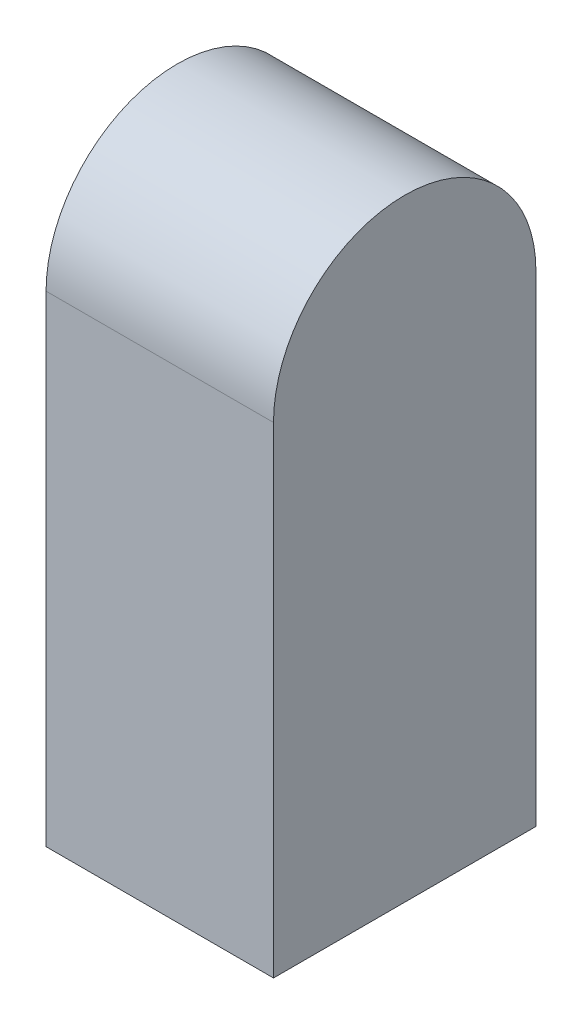
from build123d import *

# Parameters (mm, degrees)
BOSS_EXTRUDE1_DEPTH     = 2
EXTRUDE_THIN2_START     = 50
EXTRUDE_THIN2_DEPTH     = 50
RIB2_START              = -2
RIB2_OUTLINE_W          = 51
RIB2_OUTLINE_H          = 3
RIB2_DEPTH              = 4
RIB14_START             = -2
RIB14_OUTLINE_W         = 50
RIB14_OUTLINE_H         = 1
RIB14_DEPTH             = 4
LPATTERN1_COUNT         = 3
LPATTERN1_PITCH         = 53
MIRROR1_START           = -2
MIRROR1_COPY_1_SKETCH_W = 50
MIRROR1_COPY_1_SKETCH_H = 1
MIRROR1_COPY_1_DEPTH    = 4
MIRROR1_COPY_2_SKETCH_W = 50
MIRROR1_COPY_2_SKETCH_H = 1
MIRROR1_COPY_2_DEPTH    = 4
SKETCH6_R               = 1
CUT_EXTRUDE1_DEPTH      = 10


# Read off the part's stored shape, not the designer's step: Rib2, Rib14
with BuildPart() as part:
    # Sketch2 → Boss-Extrude1 (new body)
    with BuildSketch(Plane(origin=(0, 0, 0), x_dir=(0, 0, -1), z_dir=(1, 0, 0))):
        with BuildLine():
            Line((30, -70), (-30, -70))
            Line((-30, -70), (-30, 40))
            ThreePointArc((-30, 40), (0, 70), (30, 40))
            Line((30, 40), (30, -70))
        make_face()
    extrude(amount=BOSS_EXTRUDE1_DEPTH)

    # Sketch5 → Extrude-Thin2 (add)
    with BuildSketch(Plane.ZY.offset(EXTRUDE_THIN2_START)):
        with BuildLine():
            Line((-30, 40), (-30, -70))
            Line((-30, -70), (30, -70))
            Line((30, -70), (30, 40))
            ThreePointArc((30, 40), (0, 70), (-30, 40))
        make_face()
        with BuildLine():
            Line((-28, 40), (-28, -68))
            Line((-28, -68), (28, -68))
            Line((28, -68), (28, 40))
            ThreePointArc((28, 40), (0, 68), (-28, 40))
        make_face(mode=Mode.SUBTRACT)
    extrude(amount=-EXTRUDE_THIN2_DEPTH)

    # Rib2 outline → Rib2 (add)
    with BuildSketch(Plane.XY.offset(RIB2_START)):
        with Locations((-24.5, 67.5)):
            Rectangle(RIB2_OUTLINE_W, RIB2_OUTLINE_H)
    extrude(amount=RIB2_DEPTH)

    # Rib14 outline → Rib14 (add)
    with BuildSketch(Plane(origin=(0, 40, 0), x_dir=(1, 0, 0), z_dir=(0, 1, 0)).offset(RIB14_START)):
        with Locations((-25, 27.5)):
            Rectangle(RIB14_OUTLINE_W, RIB14_OUTLINE_H)
    rib14 = extrude(amount=RIB14_DEPTH)

    # LPattern1: Rib14 ×3
    with Locations(*[(0, -i * LPATTERN1_PITCH, 0) for i in range(1, LPATTERN1_COUNT)]):
        add(rib14)

    # Mirror1: Rib14 across plane
    add(rib14.mirror(Plane.XY))

    # Mirror1 copy 1 sketch → Mirror1 copy 1 (add)
    with BuildSketch(Plane(origin=(0, -13, 0), x_dir=(1, 0, 0), z_dir=(0, 1, 0)).offset(MIRROR1_START)):
        with Locations((-25, -27.5)):
            Rectangle(MIRROR1_COPY_1_SKETCH_W, MIRROR1_COPY_1_SKETCH_H)
    extrude(amount=MIRROR1_COPY_1_DEPTH)

    # Mirror1 copy 2 sketch → Mirror1 copy 2 (add)
    with BuildSketch(Plane(origin=(0, -66, 0), x_dir=(1, 0, 0), z_dir=(0, 1, 0)).offset(MIRROR1_START)):
        with Locations((-25, -27.5)):
            Rectangle(MIRROR1_COPY_2_SKETCH_W, MIRROR1_COPY_2_SKETCH_H)
    extrude(amount=MIRROR1_COPY_2_DEPTH)

    # Sketch6 → Cut-Extrude1 (cut)
    with BuildSketch(Plane.ZY.offset(50)):
        with Locations((0, 68.5)):
            Circle(SKETCH6_R)
        with Locations((-28.5, 40)):
            Circle(SKETCH6_R)
        with Locations((28.5, 40)):
            Circle(SKETCH6_R)
        with Locations((28.5, -13)):
            Circle(SKETCH6_R)
        with Locations((28.5, -66)):
            Circle(SKETCH6_R)
        with Locations((-28.5, -13)):
            Circle(SKETCH6_R)
        with Locations((-28.5, -66)):
            Circle(SKETCH6_R)
    extrude(amount=-CUT_EXTRUDE1_DEPTH, mode=Mode.SUBTRACT)


solid = part.part
